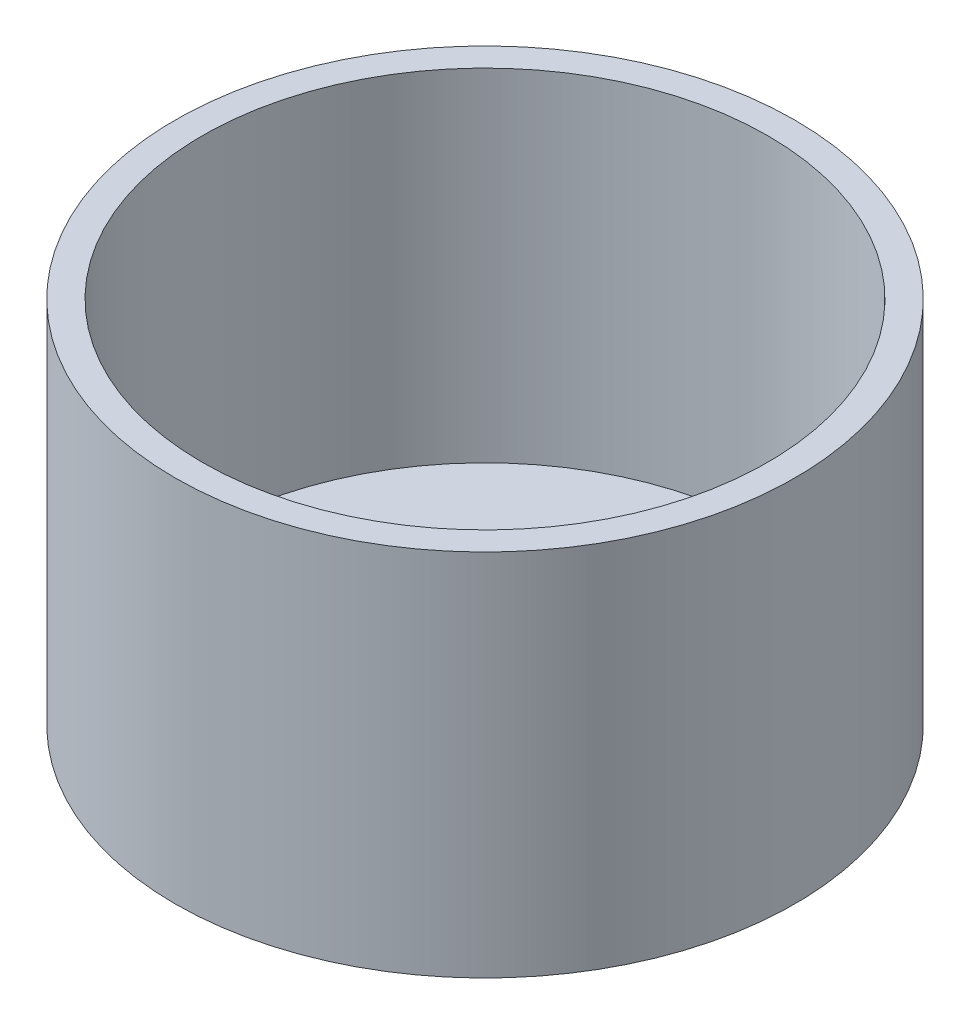
from build123d import *

# Parameters (mm, degrees)
SKETCH_2_R               = 2.2
SKETCH_2_R_2             = 1.55
CUT_EXTRUDE_1_DEPTH      = 47.584117465
PATTERN_CIRCULAR_1_COUNT = 4


with BuildPart() as part:
    # 草图1 → 旋转1 (revolve)
    with BuildSketch(Plane.XY):
        Polygon((0, 0), (25.2, 0), (25.2, 30), (23, 30), (23, 2.2), (0, 2.2), align=None)
    revolve(axis=Axis((0, 2.2, 0), (0, -1, 0)))

    # 草图2 → 切除-拉伸1 (cut, through all)
    with BuildSketch(Plane.XZ):
        Circle(SKETCH_2_R)
        with Locations((8.5, 0)):
            Circle(SKETCH_2_R_2)
    cut_extrude_1 = extrude(amount=-CUT_EXTRUDE_1_DEPTH, mode=Mode.SUBTRACT)

    # 阵列(圆周)1: 切除-拉伸1 ×4 about axis
    pattern_circular_1_axis = Axis((0, 0, 0), (0, 1, 0))
    for i in range(1, PATTERN_CIRCULAR_1_COUNT):
        add(cut_extrude_1.rotate(pattern_circular_1_axis, i * 360 / PATTERN_CIRCULAR_1_COUNT), mode=Mode.SUBTRACT)


solid = part.part
